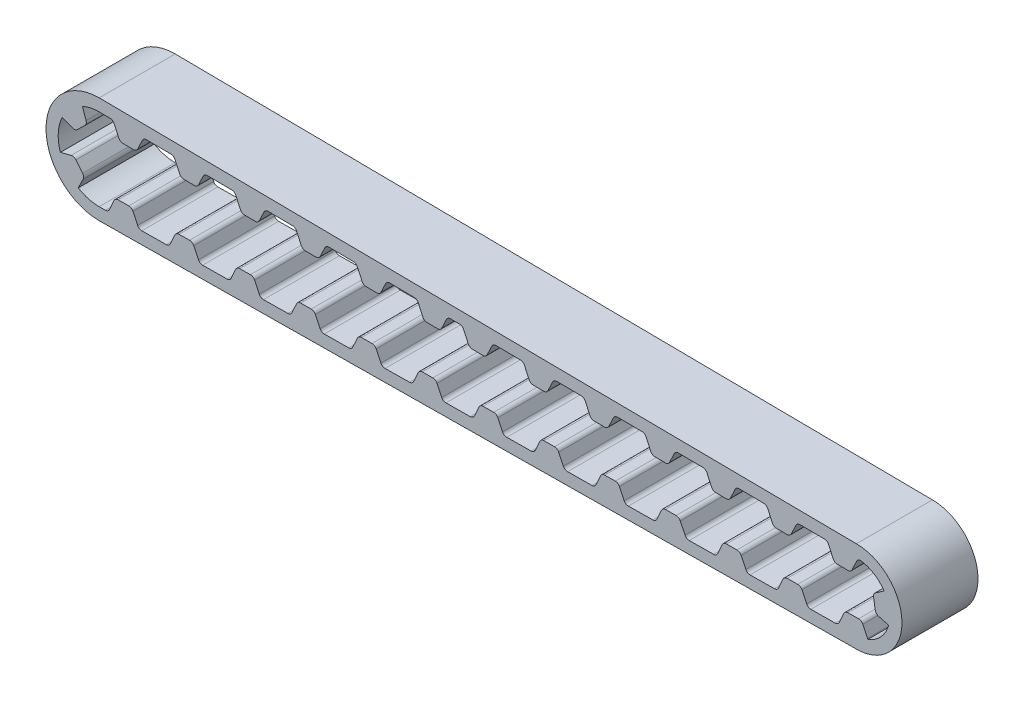
from build123d import *

# Parameters (mm, degrees)
BELT_DEPTH        = 3.175
TEETH_DEPTH       = 3.175
CRVPATTERN1_START = -3.175
CRVPATTERN1_DEPTH = 6.35


with BuildPart() as part:
    # Sketch1 → BELT (new, symmetric)
    with BuildSketch(Plane.XY):
        with BuildLine():
            Line((31.618230924, -3.81), (-31.618230924, -4.445))
            ThreePointArc((-31.618230924, -4.445), (-36.063230924, 0), (-31.618230924, 4.445))
            Line((-31.618230924, 4.445), (31.618230924, 3.81))
            ThreePointArc((31.618230924, 3.81), (35.428230924, 0), (31.618230924, -3.81))
        make_face()
        with BuildLine():
            Line((31.613524611, -2.793996036), (-31.623001493, -3.428996681))
            ThreePointArc((-31.623001493, -3.428996681), (-35.047230924, 0), (-31.623001493, 3.428996681))
            Line((-31.623001493, 3.428996681), (31.613524611, 2.793996036))
            ThreePointArc((31.613524611, 2.793996036), (34.412230924, 0), (31.613524611, -2.793996036))
        make_face(mode=Mode.SUBTRACT)
    extrude(amount=BELT_DEPTH, both=True)

    # Sketch2 → TEETH (add, symmetric)
    with BuildSketch(Plane.XY):
        with BuildLine():
            Line((-1.177615425, 2.903280475), (-0.79891773, 2.069400753))
            ThreePointArc((-0.79891773, 2.069400753), (-0.659942447, 1.907682543), (-0.455840752, 1.845962153))
            Line((-0.455840752, 1.845962153), (0.430336183, 1.837063452))
            ThreePointArc((0.430336183, 1.837063452), (0.635636148, 1.894672764), (0.777830923, 2.053567556))
            Line((0.777830923, 2.053567556), (1.173197663, 2.879674374))
            ThreePointArc((1.173197663, 2.879674374), (1.315392437, 3.038569166), (1.520692403, 3.096178478))
            Line((1.520692403, 3.096178478), (1.520692403, 3.477197687))
            Line((1.520692403, 3.477197687), (-1.520692403, 3.507738285))
            Line((-1.520692403, 3.507738285), (-1.520692403, 3.126719076))
            ThreePointArc((-1.520692403, 3.126719076), (-1.316590708, 3.064998686), (-1.177615425, 2.903280475))
        make_face()
    extrude(amount=TEETH_DEPTH, both=True)

    # CrvPattern1: read off the stored shape, not the designer's step
    # CrvPattern1 outline → CrvPattern1 (add)
    with BuildSketch(Plane.XY.offset(CRVPATTERN1_START)):
        with BuildLine():
            Line((31.618230924, 3.81), (-31.618230924, 4.445))
            ThreePointArc((-31.618230924, 4.445), (-36.063230924, 0), (-31.618230924, -4.445))
            Line((-31.618230924, -4.445), (31.618230924, -3.81))
            ThreePointArc((31.618230924, -3.81), (35.428230924, 0), (31.618230924, 3.81))
        make_face()
        with BuildLine():
            ThreePointArc((-7.695786447, 2.968738321), (-7.553591673, 3.127633113), (-7.348291708, 3.185242425))
            Line((-7.348291708, 3.185242425), (-5.309932642, 3.164771314))
            ThreePointArc((-5.309932642, 3.164771314), (-5.105830946, 3.103050923), (-4.966855664, 2.941332713))
            Line((-4.966855664, 2.941332713), (-4.588157968, 2.107452991))
            ThreePointArc((-4.588157968, 2.107452991), (-4.449182686, 1.945734781), (-4.24508099, 1.884014391))
            Line((-4.24508099, 1.884014391), (-3.358904056, 1.87511569))
            ThreePointArc((-3.358904056, 1.87511569), (-3.15360409, 1.932725002), (-3.011409316, 2.091619794))
            Line((-3.011409316, 2.091619794), (-2.616042575, 2.917726612))
            ThreePointArc((-2.616042575, 2.917726612), (-2.473847801, 3.076621404), (-2.268547836, 3.134230716))
            Line((-2.268547836, 3.134230716), (-1.520692403, 3.126719076))
            ThreePointArc((-1.520692403, 3.126719076), (-1.316590708, 3.064998686), (-1.177615425, 2.903280475))
            Line((-1.177615425, 2.903280475), (-0.79891773, 2.069400753))
            ThreePointArc((-0.79891773, 2.069400753), (-0.659942447, 1.907682543), (-0.455840752, 1.845962153))
            Line((-0.455840752, 1.845962153), (0.430336183, 1.837063452))
            ThreePointArc((0.430336183, 1.837063452), (0.635636148, 1.894672764), (0.777830923, 2.053567556))
            Line((0.777830923, 2.053567556), (1.173197663, 2.879674374))
            ThreePointArc((1.173197663, 2.879674374), (1.315392437, 3.038569166), (1.520692403, 3.096178478))
            Line((1.520692403, 3.096178478), (3.559051469, 3.075707367))
            ThreePointArc((3.559051469, 3.075707367), (3.763153165, 3.013986976), (3.902128447, 2.852268766))
            Line((3.902128447, 2.852268766), (4.280826142, 2.018389044))
            ThreePointArc((4.280826142, 2.018389044), (4.419801425, 1.856670834), (4.62390312, 1.794950444))
            Line((4.62390312, 1.794950444), (5.510080055, 1.786051743))
            ThreePointArc((5.510080055, 1.786051743), (5.71538002, 1.843661055), (5.857574795, 2.002555847))
            Line((5.857574795, 2.002555847), (6.252941535, 2.828662665))
            ThreePointArc((6.252941535, 2.828662665), (6.395136309, 2.987557457), (6.600436275, 3.045166769))
            Line((6.600436275, 3.045166769), (8.638795341, 3.024695658))
            ThreePointArc((8.638795341, 3.024695658), (8.842897037, 2.962975267), (8.981872319, 2.801257057))
            Line((8.981872319, 2.801257057), (9.360570014, 1.967377335))
            ThreePointArc((9.360570014, 1.967377335), (9.499545297, 1.805659125), (9.703646992, 1.743938735))
            Line((9.703646992, 1.743938735), (10.589823927, 1.735040034))
            ThreePointArc((10.589823927, 1.735040034), (10.795123893, 1.792649346), (10.937318667, 1.951544138))
            Line((10.937318667, 1.951544138), (11.332685407, 2.777650956))
            ThreePointArc((11.332685407, 2.777650956), (11.474880182, 2.936545748), (11.680180147, 2.99415506))
            Line((11.680180147, 2.99415506), (13.718539213, 2.973683948))
            ThreePointArc((13.718539213, 2.973683948), (13.922640909, 2.911963558), (14.061616191, 2.750245348))
            Line((14.061616191, 2.750245348), (14.440313887, 1.916365626))
            ThreePointArc((14.440313887, 1.916365626), (14.579289169, 1.754647416), (14.783390864, 1.692927025))
            Line((14.783390864, 1.692927025), (15.669567799, 1.684028325))
            ThreePointArc((15.669567799, 1.684028325), (15.874867765, 1.741637636), (16.017062539, 1.900532428))
            Line((16.017062539, 1.900532428), (16.412429279, 2.726639247))
            ThreePointArc((16.412429279, 2.726639247), (16.554624054, 2.885534039), (16.759924019, 2.943143351))
            Line((16.759924019, 2.943143351), (18.798283034, 2.92267224))
            ThreePointArc((18.798283034, 2.92267224), (19.002384759, 2.860951863), (19.141360063, 2.699233639))
            Line((19.141360063, 2.699233639), (19.520057759, 1.865353917))
            ThreePointArc((19.520057759, 1.865353917), (19.659033041, 1.703635707), (19.863134737, 1.641915316))
            Line((19.863134737, 1.641915316), (20.749311671, 1.633016615))
            ThreePointArc((20.749311671, 1.633016615), (20.954611637, 1.690625927), (21.096806411, 1.849520719))
            Line((21.096806411, 1.849520719), (21.492173152, 2.675627538))
            ThreePointArc((21.492173152, 2.675627538), (21.634367904, 2.834522316), (21.83966784, 2.892131642))
            Line((21.83966784, 2.892131642), (23.878026893, 2.871660531))
            ThreePointArc((23.878026893, 2.871660531), (24.082128626, 2.809940157), (24.221103935, 2.64822193))
            Line((24.221103935, 2.64822193), (24.599801631, 1.814342208))
            ThreePointArc((24.599801631, 1.814342208), (24.738776913, 1.652623997), (24.942878609, 1.590903607))
            Line((24.942878609, 1.590903607), (25.829055543, 1.582004906))
            ThreePointArc((25.829055543, 1.582004906), (26.034355509, 1.639614218), (26.176550283, 1.79850901))
            Line((26.176550283, 1.79850901), (26.571917024, 2.624615829))
            ThreePointArc((26.571917024, 2.624615829), (26.71411177, 2.783510603), (26.919411699, 2.841119933))
            Line((26.919411699, 2.841119933), (28.957770752, 2.820648822))
            ThreePointArc((28.957770752, 2.820648822), (29.161872492, 2.758928452), (29.300847807, 2.59721022))
            Line((29.300847807, 2.59721022), (29.679545503, 1.763330498))
            ThreePointArc((29.679545503, 1.763330498), (29.818520785, 1.601612288), (30.022622481, 1.539891898))
            Line((30.022622481, 1.539891898), (30.908799415, 1.530993197))
            ThreePointArc((30.908799415, 1.530993197), (31.114099381, 1.588602509), (31.256294155, 1.747497301))
            Line((31.256294155, 1.747497301), (31.651660896, 2.573604119))
            ThreePointArc((31.651660896, 2.573604119), (31.755175881, 2.704909484), (31.904941962, 2.779250399))
            ThreePointArc((31.904941962, 2.779250399), (33.060344556, 2.393061694), (33.941584097, 1.551923334))
            Line((33.941584097, 1.551923334), (33.213390171, 1.056813229))
            ThreePointArc((33.213390171, 1.056813229), (33.077651392, 0.892369036), (33.051526267, 0.680745818))
            Line((33.051526267, 0.680745818), (33.193405435, -0.194045042))
            ThreePointArc((33.193405435, -0.194045042), (33.285076801, -0.386563273), (33.465831617, -0.499676514))
            Line((33.465831617, -0.499676514), (34.312695908, -0.739117347))
            ThreePointArc((34.312695908, -0.739117347), (33.675865608, -1.890125791), (32.582940358, -2.622169276))
            ThreePointArc((32.582940358, -2.622169276), (32.564640666, -2.594130294), (32.548873324, -2.564592959))
            Line((32.548873324, -2.564592959), (32.153505747, -1.738486541))
            ThreePointArc((32.153505747, -1.738486541), (32.011310812, -1.579591893), (31.806010788, -1.521982789))
            Line((31.806010788, -1.521982789), (30.919833863, -1.530882387))
            ThreePointArc((30.919833863, -1.530882387), (30.71573223, -1.592602984), (30.576757111, -1.754321335))
            Line((30.576757111, -1.754321335), (30.19806026, -2.588201441))
            ThreePointArc((30.19806026, -2.588201441), (30.059085135, -2.749919796), (29.854983492, -2.811640389))
            Line((29.854983492, -2.811640389), (27.816624486, -2.832108419))
            ThreePointArc((27.816624486, -2.832108419), (27.611324419, -2.774499336), (27.469129452, -2.615604668))
            Line((27.469129452, -2.615604668), (27.073761875, -1.78949825))
            ThreePointArc((27.073761875, -1.78949825), (26.93156694, -1.630603602), (26.726266916, -1.572994498))
            Line((26.726266916, -1.572994498), (25.840089991, -1.581894096))
            ThreePointArc((25.840089991, -1.581894096), (25.635988358, -1.643614693), (25.497013239, -1.805333044))
            Line((25.497013239, -1.805333044), (25.118316388, -2.63921315))
            ThreePointArc((25.118316388, -2.63921315), (24.979341294, -2.800931485), (24.775239695, -2.862652097))
            Line((24.775239695, -2.862652097), (22.736880601, -2.883120129))
            ThreePointArc((22.736880601, -2.883120129), (22.531580542, -2.825511042), (22.38938558, -2.666616378))
            Line((22.38938558, -2.666616378), (21.994018003, -1.840509959))
            ThreePointArc((21.994018003, -1.840509959), (21.851823068, -1.681615311), (21.646523044, -1.624006207))
            Line((21.646523044, -1.624006207), (20.760346119, -1.632905806))
            ThreePointArc((20.760346119, -1.632905806), (20.556244486, -1.694626403), (20.417269367, -1.856344753))
            Line((20.417269367, -1.856344753), (20.038572516, -2.690224859))
            ThreePointArc((20.038572516, -2.690224859), (19.899597397, -2.85194321), (19.695495764, -2.913663807))
            Line((19.695495764, -2.913663807), (17.657136667, -2.934131839))
            ThreePointArc((17.657136667, -2.934131839), (17.451836643, -2.876522735), (17.309641708, -2.717628087))
            Line((17.309641708, -2.717628087), (16.914274131, -1.891521669))
            ThreePointArc((16.914274131, -1.891521669), (16.772079196, -1.732627021), (16.566779172, -1.675017917))
            Line((16.566779172, -1.675017917), (15.680602247, -1.683917515))
            ThreePointArc((15.680602247, -1.683917515), (15.476500614, -1.745638112), (15.337525495, -1.907356463))
            Line((15.337525495, -1.907356463), (14.958828644, -2.741236568))
            ThreePointArc((14.958828644, -2.741236568), (14.819853525, -2.902954919), (14.615751892, -2.964675516))
            Line((14.615751892, -2.964675516), (12.577392795, -2.985143548))
            ThreePointArc((12.577392795, -2.985143548), (12.372092771, -2.927534444), (12.229897836, -2.768639796))
            Line((12.229897836, -2.768639796), (11.834530259, -1.942533378))
            ThreePointArc((11.834530259, -1.942533378), (11.692335324, -1.78363873), (11.4870353, -1.726029626))
            Line((11.4870353, -1.726029626), (10.600858375, -1.734929224))
            ThreePointArc((10.600858375, -1.734929224), (10.396756742, -1.796649821), (10.257781623, -1.958368172))
            Line((10.257781623, -1.958368172), (9.879084772, -2.792248277))
            ThreePointArc((9.879084772, -2.792248277), (9.740109653, -2.953966628), (9.53600802, -3.015687225))
            Line((9.53600802, -3.015687225), (7.497648923, -3.036155257))
            ThreePointArc((7.497648923, -3.036155257), (7.292348899, -2.978546153), (7.150153964, -2.819651505))
            Line((7.150153964, -2.819651505), (6.754786387, -1.993545087))
            ThreePointArc((6.754786387, -1.993545087), (6.612591452, -1.834650439), (6.407291428, -1.777041335))
            Line((6.407291428, -1.777041335), (5.521114503, -1.785940933))
            ThreePointArc((5.521114503, -1.785940933), (5.31701287, -1.84766153), (5.178037751, -2.009379881))
            Line((5.178037751, -2.009379881), (4.7993409, -2.843259986))
            ThreePointArc((4.7993409, -2.843259986), (4.660365781, -3.004978337), (4.456264148, -3.066698934))
            Line((4.456264148, -3.066698934), (2.417905051, -3.087166966))
            ThreePointArc((2.417905051, -3.087166966), (2.212605027, -3.029557862), (2.070410092, -2.870663214))
            Line((2.070410092, -2.870663214), (1.675042515, -2.044556796))
            ThreePointArc((1.675042515, -2.044556796), (1.53284758, -1.885662148), (1.327547556, -1.828053044))
            Line((1.327547556, -1.828053044), (0.441370631, -1.836952642))
            ThreePointArc((0.441370631, -1.836952642), (0.237268998, -1.898673239), (0.098293879, -2.06039159))
            Line((0.098293879, -2.06039159), (-0.280402972, -2.894271696))
            ThreePointArc((-0.280402972, -2.894271696), (-0.419378091, -3.055990046), (-0.623479724, -3.117710643))
            Line((-0.623479724, -3.117710643), (-2.661838821, -3.138178675))
            ThreePointArc((-2.661838821, -3.138178675), (-2.867138845, -3.080569571), (-3.00933378, -2.921674923))
            Line((-3.00933378, -2.921674923), (-3.404701357, -2.095568505))
            ThreePointArc((-3.404701357, -2.095568505), (-3.546896292, -1.936673857), (-3.752196316, -1.879064753))
            Line((-3.752196316, -1.879064753), (-4.638373241, -1.887964351))
            ThreePointArc((-4.638373241, -1.887964351), (-4.842474874, -1.949684948), (-4.981449993, -2.111403299))
            Line((-4.981449993, -2.111403299), (-5.360146844, -2.945283405))
            ThreePointArc((-5.360146844, -2.945283405), (-5.499121963, -3.107001756), (-5.703223596, -3.168722353))
            Line((-5.703223596, -3.168722353), (-7.741582693, -3.189190384))
            ThreePointArc((-7.741582693, -3.189190384), (-7.946882717, -3.13158128), (-8.089077652, -2.972686632))
            Line((-8.089077652, -2.972686632), (-8.484445229, -2.146580214))
            ThreePointArc((-8.484445229, -2.146580214), (-8.626640164, -1.987685566), (-8.831940188, -1.930076462))
            Line((-8.831940188, -1.930076462), (-9.718117113, -1.938976061))
            ThreePointArc((-9.718117113, -1.938976061), (-9.922218746, -2.000696657), (-10.061193865, -2.162415008))
            Line((-10.061193865, -2.162415008), (-10.439890716, -2.996295114))
            ThreePointArc((-10.439890716, -2.996295114), (-10.578865835, -3.158013465), (-10.782967468, -3.219734062))
            Line((-10.782967468, -3.219734062), (-12.821326565, -3.240202094))
            ThreePointArc((-12.821326565, -3.240202094), (-13.026626589, -3.18259299), (-13.168821524, -3.023698342))
            Line((-13.168821524, -3.023698342), (-13.564189101, -2.197591923))
            ThreePointArc((-13.564189101, -2.197591923), (-13.706384036, -2.038697276), (-13.91168406, -1.981088172))
            Line((-13.91168406, -1.981088172), (-14.797860986, -1.98998777))
            ThreePointArc((-14.797860986, -1.98998777), (-15.001962618, -2.051708367), (-15.140937737, -2.213426718))
            Line((-15.140937737, -2.213426718), (-15.519634588, -3.047306823))
            ThreePointArc((-15.519634588, -3.047306823), (-15.658609707, -3.209025174), (-15.86271134, -3.270745771))
            Line((-15.86271134, -3.270745771), (-17.901070437, -3.291213803))
            ThreePointArc((-17.901070437, -3.291213803), (-18.106370461, -3.233604699), (-18.248565396, -3.074710051))
            Line((-18.248565396, -3.074710051), (-18.643932973, -2.248603633))
            ThreePointArc((-18.643932973, -2.248603633), (-18.786127908, -2.089708985), (-18.991427932, -2.032099881))
            Line((-18.991427932, -2.032099881), (-19.877604858, -2.040999479))
            ThreePointArc((-19.877604858, -2.040999479), (-20.081706491, -2.102720076), (-20.220681609, -2.264438427))
            Line((-20.220681609, -2.264438427), (-20.59937846, -3.098318532))
            ThreePointArc((-20.59937846, -3.098318532), (-20.737121897, -3.259231321), (-20.939512054, -3.321716552))
            Line((-20.939512054, -3.321716552), (-22.983691992, -3.342243543))
            ThreePointArc((-22.983691992, -3.342243543), (-23.187334129, -3.283853223), (-23.328309268, -3.12572176))
            Line((-23.328309268, -3.12572176), (-23.723676845, -2.299615342))
            ThreePointArc((-23.723676845, -2.299615342), (-23.86587178, -2.140720694), (-24.071171804, -2.08311159))
            Line((-24.071171804, -2.08311159), (-24.95734873, -2.092011188))
            ThreePointArc((-24.95734873, -2.092011188), (-25.161450363, -2.153731785), (-25.300425481, -2.315450136))
            Line((-25.300425481, -2.315450136), (-25.679122332, -3.149330241))
            ThreePointArc((-25.679122332, -3.149330241), (-25.816733763, -3.31015629), (-26.018940072, -3.372722518))
            Line((-26.018940072, -3.372722518), (-28.06375834, -3.393255918))
            ThreePointArc((-28.06375834, -3.393255918), (-28.26721451, -3.334779124), (-28.40805314, -3.176733469))
            Line((-28.40805314, -3.176733469), (-28.803420717, -2.350627051))
            ThreePointArc((-28.803420717, -2.350627051), (-28.945615652, -2.191732403), (-29.150915676, -2.134123299))
            Line((-29.150915676, -2.134123299), (-30.037092602, -2.143022897))
            ThreePointArc((-30.037092602, -2.143022897), (-30.241194235, -2.204743494), (-30.380169353, -2.366461845))
            Line((-30.380169353, -2.366461845), (-30.758866204, -3.20034195))
            ThreePointArc((-30.758866204, -3.20034195), (-30.896357369, -3.361088906), (-31.098396108, -3.423728765))
            Line((-31.098396108, -3.423728765), (-31.623001493, -3.428996681))
            ThreePointArc((-31.623001493, -3.428996681), (-32.528379185, -3.306005315), (-33.36913521, -2.94828343))
            ThreePointArc((-33.36913521, -2.94828343), (-33.366661573, -2.942852593), (-33.364103179, -2.937461165))
            Line((-33.364103179, -2.937461165), (-32.96500414, -2.113150974))
            ThreePointArc((-32.96500414, -2.113150974), (-32.92950109, -1.902897693), (-33.012527127, -1.706496099))
            Line((-33.012527127, -1.706496099), (-33.572231925, -1.01938673))
            ThreePointArc((-33.572231925, -1.01938673), (-33.747781874, -0.898353164), (-33.960870487, -0.890597407))
            Line((-33.960870487, -0.890597407), (-34.848864646, -1.114726184))
            ThreePointArc((-34.848864646, -1.114726184), (-34.854456859, -1.116092797), (-34.860069082, -1.117374761))
            ThreePointArc((-34.860069082, -1.117374761), (-35.041596838, 0.196486191), (-34.710936647, 1.480949801))
            ThreePointArc((-34.710936647, 1.480949801), (-34.705306818, 1.478970433), (-34.699708682, 1.476903131))
            Line((-34.699708682, 1.476903131), (-33.843086028, 1.152920162))
            ThreePointArc((-33.843086028, 1.152920162), (-33.630504065, 1.136312407), (-33.442290915, 1.236525774))
            Line((-33.442290915, 1.236525774), (-32.80784382, 1.855287141))
            ThreePointArc((-32.80784382, 1.855287141), (-32.702951062, 2.040933089), (-32.714232903, 2.253864131))
            Line((-32.714232903, 2.253864131), (-33.016673978, 3.118327394))
            ThreePointArc((-33.016673978, 3.118327394), (-33.018533948, 3.12377542), (-33.02031139, 3.129250928))
            ThreePointArc((-33.02031139, 3.129250928), (-32.337445313, 3.352726005), (-31.623001493, 3.428996681))
            Line((-31.623001493, 3.428996681), (-30.705296683, 3.419781388))
            ThreePointArc((-30.705296683, 3.419781388), (-30.503146375, 3.35719071), (-30.365575024, 3.196391259))
            Line((-30.365575024, 3.196391259), (-29.986877328, 2.362511537))
            ThreePointArc((-29.986877328, 2.362511537), (-29.847902046, 2.200793327), (-29.643800351, 2.139072936))
            Line((-29.643800351, 2.139072936), (-28.757623416, 2.130174236))
            ThreePointArc((-28.757623416, 2.130174236), (-28.55232345, 2.187783547), (-28.410128676, 2.346678339))
            Line((-28.410128676, 2.346678339), (-28.014761936, 3.172785158))
            ThreePointArc((-28.014761936, 3.172785158), (-27.87398926, 3.330789569), (-27.670622811, 3.389308179))
            Line((-27.670622811, 3.389308179), (-25.625858712, 3.368775323))
            ThreePointArc((-25.625858712, 3.368775323), (-25.423530338, 3.306263025), (-25.285831152, 3.14537955))
            Line((-25.285831152, 3.14537955), (-24.907133456, 2.311499828))
            ThreePointArc((-24.907133456, 2.311499828), (-24.768158174, 2.149781617), (-24.564056478, 2.088061227))
            Line((-24.564056478, 2.088061227), (-23.677879544, 2.079162526))
            ThreePointArc((-23.677879544, 2.079162526), (-23.472579578, 2.136771838), (-23.330384804, 2.29566663))
            Line((-23.330384804, 2.29566663), (-22.935018063, 3.121773449))
            ThreePointArc((-22.935018063, 3.121773449), (-22.794115891, 3.279859299), (-22.590572987, 3.33829597))
            Line((-22.590572987, 3.33829597), (-20.549164258, 3.317806441))
            ThreePointArc((-20.549164258, 3.317806441), (-20.345062562, 3.256086051), (-20.20608728, 3.094367841))
            Line((-20.20608728, 3.094367841), (-19.827389584, 2.260488119))
            ThreePointArc((-19.827389584, 2.260488119), (-19.688414302, 2.098769908), (-19.484312606, 2.037049518))
            Line((-19.484312606, 2.037049518), (-18.598135672, 2.028150817))
            ThreePointArc((-18.598135672, 2.028150817), (-18.392835706, 2.085760129), (-18.250640932, 2.244654921))
            Line((-18.250640932, 2.244654921), (-17.855274191, 3.070761739))
            ThreePointArc((-17.855274191, 3.070761739), (-17.713079417, 3.229656531), (-17.507779452, 3.287265843))
            Line((-17.507779452, 3.287265843), (-15.469420386, 3.266794732))
            ThreePointArc((-15.469420386, 3.266794732), (-15.26531869, 3.205074342), (-15.126343408, 3.043356131))
            Line((-15.126343408, 3.043356131), (-14.747645712, 2.209476409))
            ThreePointArc((-14.747645712, 2.209476409), (-14.60867043, 2.047758199), (-14.404568734, 1.986037809))
            Line((-14.404568734, 1.986037809), (-13.5183918, 1.977139108))
            ThreePointArc((-13.5183918, 1.977139108), (-13.313091834, 2.03474842), (-13.17089706, 2.193643212))
            Line((-13.17089706, 2.193643212), (-12.775530319, 3.01975003))
            ThreePointArc((-12.775530319, 3.01975003), (-12.633335545, 3.178644822), (-12.42803558, 3.236254134))
            Line((-12.42803558, 3.236254134), (-10.389676514, 3.215783023))
            ThreePointArc((-10.389676514, 3.215783023), (-10.185574818, 3.154062632), (-10.046599536, 2.992344422))
            Line((-10.046599536, 2.992344422), (-9.66790184, 2.1584647))
            ThreePointArc((-9.66790184, 2.1584647), (-9.528926558, 1.99674649), (-9.324824862, 1.9350261))
            Line((-9.324824862, 1.9350261), (-8.438647928, 1.926127399))
            ThreePointArc((-8.438647928, 1.926127399), (-8.233347962, 1.983736711), (-8.091153188, 2.142631503))
            Line((-8.091153188, 2.142631503), (-7.695786447, 2.968738321))
        make_face(mode=Mode.SUBTRACT)
    extrude(amount=CRVPATTERN1_DEPTH)


solid = part.part
